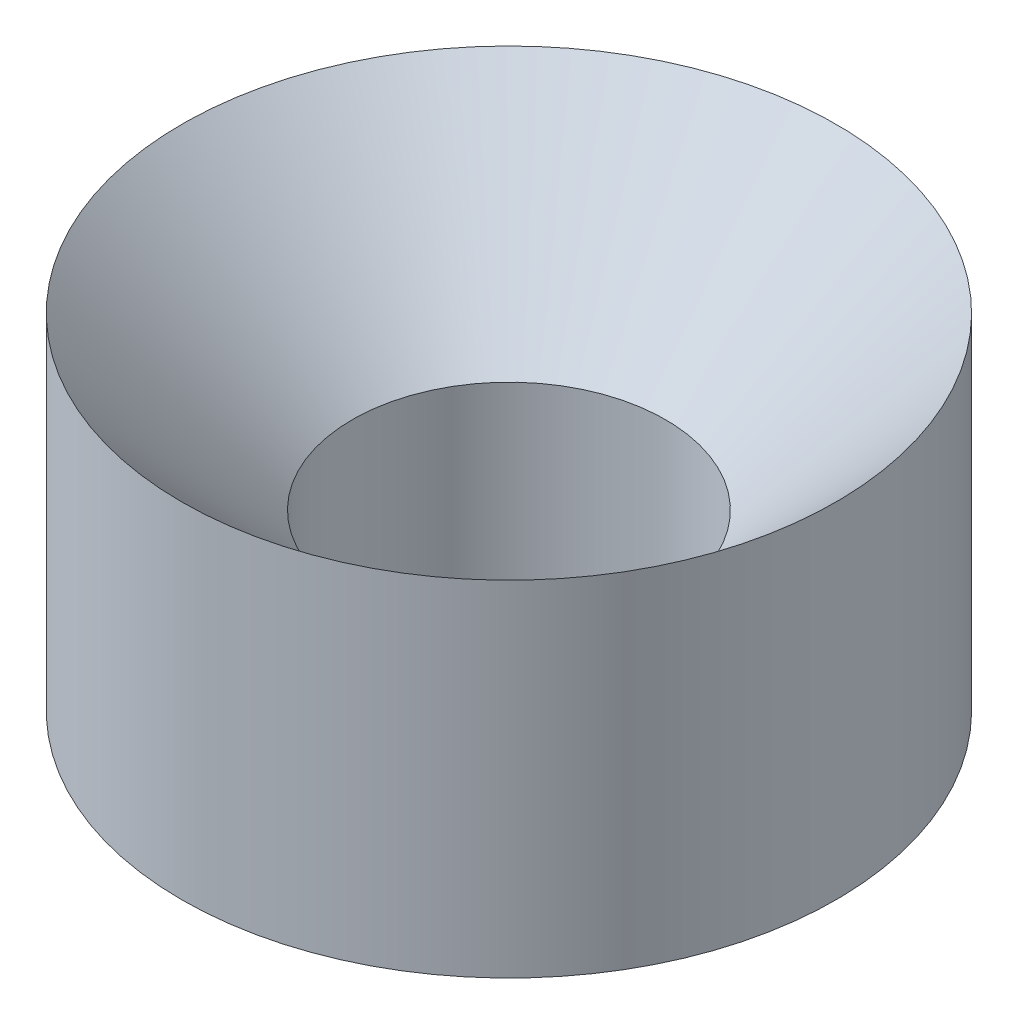
from build123d import *

# Parameters (mm, degrees)
SKETCH1_R           = 4.7
BOSS_EXTRUDE1_DEPTH = 5
SKETCH2_R           = 2.25
CUT_EXTRUDE1_DEPTH  = 9.317451533
CHAMFER1_SIZE       = 2.5


with BuildPart() as part:
    # Sketch1 → Boss-Extrude1 (new body)
    with BuildSketch(Plane(origin=(0, 0, 0), x_dir=(1, 0, 0), z_dir=(0, 1, 0))):
        with Locations(Location((0, 0, 0), (0, 0, 270))):
            Circle(SKETCH1_R)
    extrude(amount=BOSS_EXTRUDE1_DEPTH)

    # Sketch2 → Cut-Extrude1 (cut, through all)
    with BuildSketch(Plane(origin=(0, 5, 0), x_dir=(1, 0, 0), z_dir=(0, 1, 0))):
        with Locations(Location((0, 0, 0), (0, 0, 270))):
            Circle(SKETCH2_R)
    extrude(amount=-CUT_EXTRUDE1_DEPTH, mode=Mode.SUBTRACT)

    # Chamfer1
    # the kernel refuses this chamfer: 2.5 mm, written as the material it takes off along each edge
    with BuildSketch(Plane(origin=(0, 5, 0), x_dir=(0, 0, 1), z_dir=(-1, 0, 0))) as chamfer1_piece_1:
        Polygon((2.25 + CHAMFER1_SIZE, 0), (2.25, -CHAMFER1_SIZE), (2.25, 0), align=None)
    revolve(axis=Axis((0, 5, 0), (0, 1, 0)), mode=Mode.SUBTRACT)


solid = part.part
